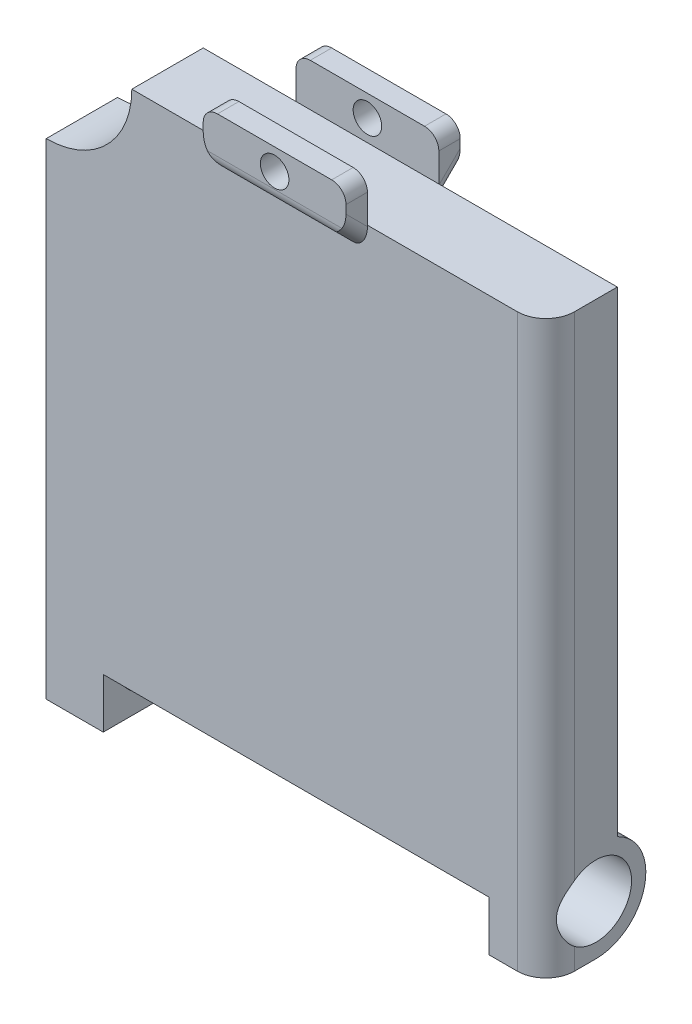
from build123d import *

# Parameters (mm, degrees)
SKETCH1_W           = 35
SKETCH1_H           = 36.5
BOSS_EXTRUDE1_DEPTH = 2.5
SKETCH3_R           = 3.5
CUT_EXTRUDE1_DEPTH  = 35
SKETCH4_R           = 2.5
BOSS_EXTRUDE3_DEPTH = 4
SKETCH5_W           = 1.5
SKETCH5_H           = 3
BOSS_EXTRUDE4_DEPTH = 5
CUT_EXTRUDE2_REACH  = 55.456
SKETCH6_R           = 1
FILLET1_R           = 1
FILLET2_R           = 1
SKETCH7_R           = 6
CUT_EXTRUDE3_DEPTH  = 5
FILLET3_R           = 2


with BuildPart() as part:
    # Sketch1 → Boss-Extrude1 (new, symmetric)
    with BuildSketch(Plane.XY):
        with Locations((17.5, 18.25)):
            Rectangle(SKETCH1_W, SKETCH1_H)
    extrude(amount=BOSS_EXTRUDE1_DEPTH, both=True)

    # Sketch3 → Cut-Extrude1 (cut)
    with BuildSketch(Plane(origin=(35, 0, 0), x_dir=(0, 0, -1), z_dir=(1, 0, 0))):
        with Locations((1, 0)):
            Circle(SKETCH3_R)
    extrude(amount=-CUT_EXTRUDE1_DEPTH, mode=Mode.SUBTRACT)

    # Sketch4 → Boss-Extrude3 (add)
    # profile 1 of 2: a face of its own
    with BuildSketch(Plane(origin=(35, 0, 0), x_dir=(0, 0, -1), z_dir=(1, 0, 0))):
        with BuildLine():
            ThreePointArc((2.5, 3.16227766), (-0.870828693, 2.958039892), (-2.5, 0))
            ThreePointArc((-2.5, 0), (-1.474873734, -2.474873734), (1, -3.5))
            ThreePointArc((1, -3.5), (3.474873734, -2.474873734), (4.5, 0))
            ThreePointArc((4.5, 0), (3.958039892, 1.870828693), (2.5, 3.16227766))
        make_face()
        with Locations((1, 0)):
            Circle(SKETCH4_R, mode=Mode.SUBTRACT)
    # profile 2 of 2: a face of its own
    with BuildSketch(Plane(origin=(35, 0, 0), x_dir=(0, 0, -1), z_dir=(1, 0, 0))):
        with BuildLine():
            ThreePointArc((1, -3.5), (-1.474873734, -2.474873734), (-2.5, 0))
            Line((-2.5, 0), (-2.5, -3.5))
            Line((-2.5, -3.5), (1, -3.5))
        make_face()
    boss_extrude3 = extrude(amount=-BOSS_EXTRUDE3_DEPTH)

    # Mirror2: Boss-Extrude3 across plane
    add(boss_extrude3.mirror(Plane(origin=(17.5, 0, 0), x_dir=(0, 0, 1), z_dir=(1, 0, 0))))

    # Sketch5 → Boss-Extrude4 (add, symmetric)
    with BuildSketch(Plane(origin=(17.5, 0, 0), x_dir=(0, 0, -1), z_dir=(1, 0, 0))):
        with Locations((-3.25, 38)):
            Rectangle(SKETCH5_W, SKETCH5_H)
        Polygon((-4, 36.5), (-2.5, 35), (-2.5, 36.5), align=None)
        Polygon((2.5, 35), (2.5, 36.5), (4, 36.5), align=None)
        with Locations((3.25, 38)):
            Rectangle(SKETCH5_W, SKETCH5_H)
    extrude(amount=BOSS_EXTRUDE4_DEPTH, both=True)

    # Cut-Extrude2: up to this face of the body (flat: up to its plane)
    cut_extrude2_end = Plane(part.part.faces().sort_by_distance((17.5, 38, -4))[0])
    # Sketch6 → Cut-Extrude2 (cut, up to the picked face)
    with BuildSketch(Plane.XY.offset(4), mode=Mode.PRIVATE) as cut_extrude2_sk1:
        with Locations(Location((17.5, 38, 0), (0, 0, 270))):
            Circle(SKETCH6_R)
    cut_extrude2_tool1 = split(extrude(cut_extrude2_sk1.sketch, amount=-CUT_EXTRUDE2_REACH, mode=Mode.PRIVATE), bisect_by=cut_extrude2_end, keep=Keep.BOTH, mode=Mode.PRIVATE)
    add(cut_extrude2_tool1.solids().sort_by(Axis((17.5, 38, 4), (0, 0, -1)))[0], mode=Mode.SUBTRACT)

    # Fillet1
    fillet1_edges = [part.edges().sort_by_distance(p)[0] for p in [
        (12.5, 35.75, 3.25),
        (17.5, 36.5, 4),
        (22.5, 35.75, 3.25),
        (22.5, 35.75, -3.25),
        (17.5, 36.5, -4),
        (12.5, 35.75, -3.25),
    ]]
    fillet(fillet1_edges, radius=FILLET1_R)

    # Fillet2
    fillet2_edges = [part.edges().sort_by_distance(p)[0] for p in [
        (22.5, 39.5, 3.25),
        (12.5, 39.5, 3.25),
        (22.5, 39.5, -3.25),
        (12.5, 39.5, -3.25),
    ]]
    fillet(fillet2_edges, radius=FILLET2_R)

    # Sketch7 → Cut-Extrude3 (cut)
    with BuildSketch(Plane.XY.offset(2.5)):
        with Locations((0, 36.5)):
            Circle(SKETCH7_R)
    extrude(amount=-CUT_EXTRUDE3_DEPTH, mode=Mode.SUBTRACT)

    # Fillet3
    # the kernel refuses this fillet: 2 mm, written as the material it takes off along each edge
    with BuildSketch(Plane(origin=(35, -8.5, 2.5), x_dir=(-1, 0, 0), z_dir=(0, 1, 0))) as fillet3_piece_1:
        with BuildLine():
            CenterArc((FILLET3_R, -FILLET3_R), FILLET3_R, 90, 90)
            Line((0, -FILLET3_R), (0, 0))
            Line((0, 0), (FILLET3_R, 0))
        make_face()
    extrude(amount=50, mode=Mode.SUBTRACT)


solid = part.part
